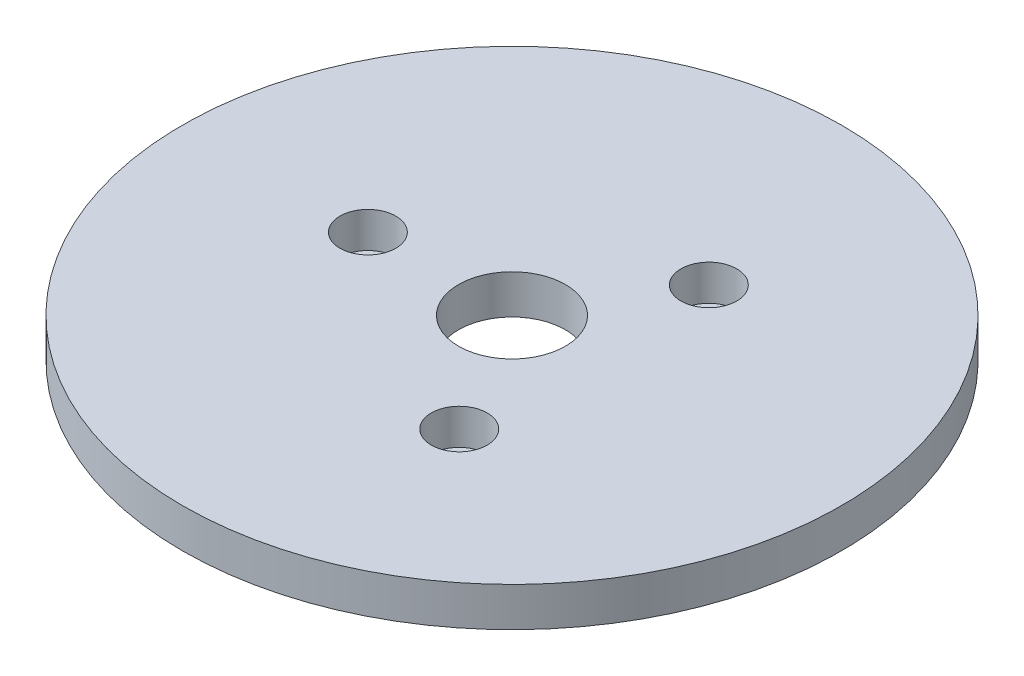
from build123d import *

# Parameters (mm, degrees)
SKETCH1_R           = 92.5
BOSS_EXTRUDE1_DEPTH = 11
SKETCH2_R           = 15
CUT_EXTRUDE1_DEPTH  = 132.276425911
SKETCH3_R           = 7.837597268
CUT_EXTRUDE2_DEPTH  = 10.005702061
CIRPATTERN1_COUNT   = 3


with BuildPart() as part:
    # Sketch1 → Boss-Extrude1 (new body)
    with BuildSketch(Plane(origin=(0, 0, 0), x_dir=(1, 0, 0), z_dir=(0, 1, 0))):
        Circle(SKETCH1_R)
    extrude(amount=BOSS_EXTRUDE1_DEPTH)

    # Sketch2 → Cut-Extrude1 (cut, through all)
    with BuildSketch(Plane(origin=(0, 0, 0), x_dir=(1, 0, 0), z_dir=(0, 1, 0))):
        Circle(SKETCH2_R)
    extrude(amount=CUT_EXTRUDE1_DEPTH, mode=Mode.SUBTRACT)

    # Sketch3 → Cut-Extrude2 (cut)
    with BuildSketch(Plane(origin=(0, 11, 0), x_dir=(1, 0, 0), z_dir=(0, 1, 0))):
        with Locations((-40.446078013, 0)):
            Circle(SKETCH3_R)
    cut_extrude2 = extrude(amount=-CUT_EXTRUDE2_DEPTH, mode=Mode.SUBTRACT)

    # CirPattern1: Cut-Extrude2 ×3 about axis
    cirpattern1_axis = Axis((0, 0, 0), (0, 1, 0))
    for i in range(1, CIRPATTERN1_COUNT):
        add(cut_extrude2.rotate(cirpattern1_axis, i * 360 / CIRPATTERN1_COUNT), mode=Mode.SUBTRACT)


solid = part.part
